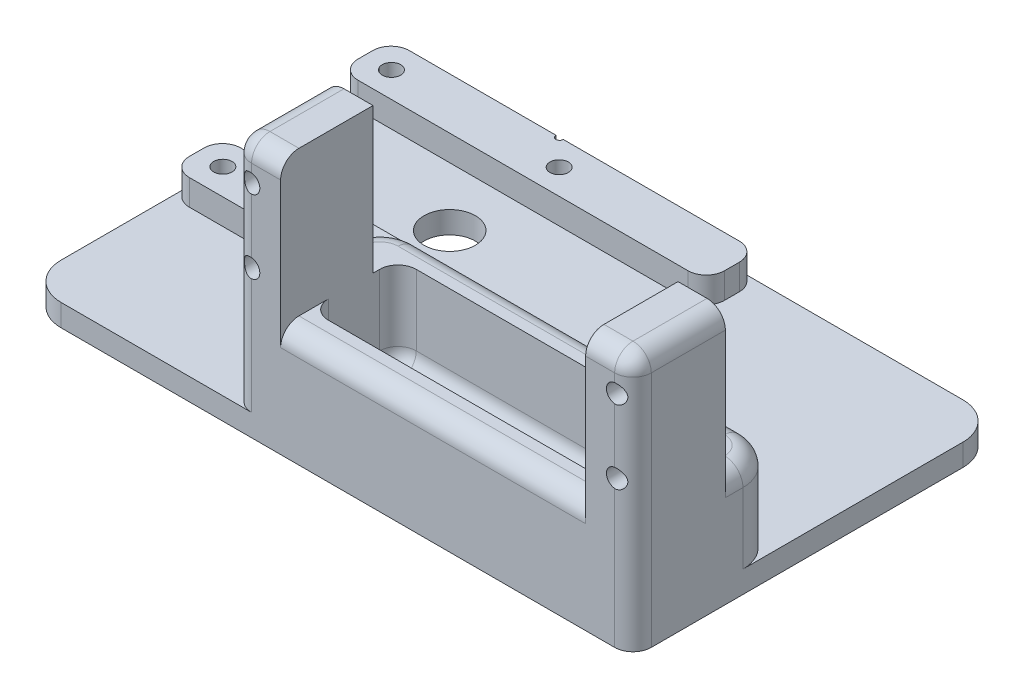
from build123d import *

# Parameters (mm, degrees)
SKETCH1_W             = 83
SKETCH1_H             = 50
BOSS_EXTRUDE1_DEPTH   = 3
SKETCH2_W             = 50
SKETCH2_H             = 7
BOSS_EXTRUDE2_DEPTH   = 3.5
SKETCH3_W             = 6.457447236
SKETCH3_H             = 12.6
BOSS_EXTRUDE3_DEPTH   = 31.93
M3X0_5_TAPPED_HOLE1_D = 2.5
SKETCH6_W             = 54.514894472
SKETCH6_H             = 20
BOSS_EXTRUDE4_DEPTH   = 12.13
SKETCH10_W            = 41.6
SKETCH10_H            = 12
CUT_EXTRUDE2_DEPTH    = 12.13
FILLET1_R             = 5
FILLET2_R             = 5
FILLET3_R             = 2.5
FILLET4_R             = 2.5
FILLET5_R             = 2.5
M3X0_5_TAPPED_HOLE2_D = 2.5
SKETCH9_R             = 3.5
CUT_EXTRUDE1_DEPTH    = 59.023916735
FILLET6_R             = 2.5
CUT_EXTRUDE3_DEPTH    = 60.727338073


with BuildPart() as part:
    # Sketch1 → Boss-Extrude1 (new body)
    with BuildSketch(Plane(origin=(0, 0, 0), x_dir=(1, 0, 0), z_dir=(0, 1, 0))):
        Rectangle(SKETCH1_W, SKETCH1_H)
    extrude(amount=BOSS_EXTRUDE1_DEPTH)

    # Sketch2 → Boss-Extrude2 (add)
    with BuildSketch(Plane(origin=(0, 3, 0), x_dir=(1, 0, 0), z_dir=(0, 1, 0))):
        with Locations((-16.5, 21.5)):
            Rectangle(SKETCH2_W, SKETCH2_H)
        with Locations((-16.5, -1.5)):
            Rectangle(SKETCH2_W, SKETCH2_H)
    extrude(amount=BOSS_EXTRUDE2_DEPTH)

    # Sketch3 → Boss-Extrude3 (add)
    with BuildSketch(Plane(origin=(0, 3, 0), x_dir=(1, 0, 0), z_dir=(0, 1, 0))):
        with Locations((38.271276382, -18.7)):
            Rectangle(SKETCH3_W, SKETCH3_H)
        with Locations((-9.786170854, -18.7)):
            Rectangle(SKETCH3_W, SKETCH3_H)
    extrude(amount=BOSS_EXTRUDE3_DEPTH)

    # M3x0.5 Tapped Hole1 (through all)
    with Locations(Plane(origin=(0, 0, 12.4), x_dir=(-1, 0, 0), z_dir=(0, 0, -1))):
        with Locations((-39.132166065, 30.03), (-39.132166065, 20.03), (10.647060537, 20.03), (10.647060537, 30.03)):
            Hole(M3X0_5_TAPPED_HOLE1_D / 2)

    # Sketch6 → Boss-Extrude4 (add)
    with BuildSketch(Plane(origin=(0, 3, 0), x_dir=(1, 0, 0), z_dir=(0, 1, 0))):
        with Locations((14.242552764, -15)):
            Rectangle(SKETCH6_W, SKETCH6_H)
    extrude(amount=BOSS_EXTRUDE4_DEPTH)

    # Sketch10 → Cut-Extrude2 (cut)
    with BuildSketch(Plane(origin=(0, 15.13, 0), x_dir=(1, 0, 0), z_dir=(0, 1, 0))):
        with Locations((14.242552764, -15)):
            Rectangle(SKETCH10_W, SKETCH10_H)
    extrude(amount=-CUT_EXTRUDE2_DEPTH, mode=Mode.SUBTRACT)

    # Fillet1
    fillet1_edges = [part.edges().sort_by_distance(p)[0] for p in [
        (8.5, 4.75, 5),
        (41.5, 9.065, 5),
        (-13.014894472, 4.75, 5),
    ]]
    fillet(fillet1_edges, radius=FILLET1_R)

    # Fillet2
    fillet2_edges = [part.edges().sort_by_distance(p)[0] for p in [
        (-13.014894472, 10.815, 5),
        (-41.5, 1.5, 25),
        (41.5, 1.5, -25),
    ]]
    fillet(fillet2_edges, radius=FILLET2_R)

    # Fillet3
    fillet3_edges = [part.edges().sort_by_distance(p)[0] for p in [
        (8.5, 4.75, -18),
        (-41.5, 4.75, -18),
        (-41.5, 4.75, -2),
        (8.5, 4.75, -2),
        (8.5, 4.75, -25),
        (-41.5, 4.75, 5),
        (-41.5, 3.25, -25),
    ]]
    fillet(fillet3_edges, radius=FILLET3_R)

    # Fillet4
    fillet4_edges = [part.edges().sort_by_distance(p)[0] for p in [
        (14.242552764, 15.13, 5),
        (40.035533906, 15.13, 6.464466094),
        (-13.014894472, 15.13, 11.2),
        (-11.550428378, 15.13, 6.464466094),
        (41.5, 15.13, 11.2),
        (14.242552764, 15.13, 25),
    ]]
    fillet(fillet4_edges, radius=FILLET4_R)

    # Fillet5
    # the kernel refuses this fillet: 2.5 mm, written as the material it takes off along each edge
    with BuildSketch(Plane(origin=(39, 32.43, 22.5), x_dir=(1, 0, 0), z_dir=(0, 0, 1))) as fillet5_piece_1_section:
        Polygon((0, 0), (FILLET5_R * 1.02, 0), (FILLET5_R * 1.02, FILLET5_R * 1.02), (0, FILLET5_R * 1.02), align=None)
    fillet5_piece_1 = extrude(amount=FILLET5_R * 1.02, mode=Mode.PRIVATE)
    fillet5_piece_1 = fillet5_piece_1 - Plane(origin=(39, 32.43, 22.5), x_dir=(-0.7071067811865475, -0.7071067811865475, 0), z_dir=(0, 0, 1)) * Sphere(FILLET5_R, mode=Mode.PRIVATE)
    add(fillet5_piece_1, mode=Mode.SUBTRACT)
    with BuildSketch(Plane(origin=(-10.514894472, 32.43, 22.5), x_dir=(-1, 0, 0), z_dir=(0, 0, 1))) as fillet5_piece_2_section:
        Polygon((0, 0), (FILLET5_R * 1.02, 0), (FILLET5_R * 1.02, -FILLET5_R * 1.02), (0, -FILLET5_R * 1.02), align=None)
    fillet5_piece_2 = extrude(amount=FILLET5_R * 1.02, mode=Mode.PRIVATE)
    fillet5_piece_2 = fillet5_piece_2 - Plane(origin=(-10.514894472, 32.43, 22.5), x_dir=(0.7071067811865475, -0.7071067811865475, 0), z_dir=(0, 0, 1)) * Sphere(FILLET5_R, mode=Mode.PRIVATE)
    add(fillet5_piece_2, mode=Mode.SUBTRACT)
    with BuildSketch(Plane(origin=(39, 34.93, 25), x_dir=(0, -1, 0), z_dir=(-1, 0, 0))) as fillet5_piece_3:
        with BuildLine():
            CenterArc((FILLET5_R, -FILLET5_R), FILLET5_R, 90, 90)
            Line((0, -FILLET5_R), (0, 0))
            Line((0, 0), (FILLET5_R, 0))
        make_face()
    extrude(amount=10.207447236, mode=Mode.SUBTRACT)
    with BuildSketch(Plane(origin=(41.5, 34.93, 6.15), x_dir=(-1, 0, 0), z_dir=(0, 0, 1)), Plane(origin=(-13.014894472, 34.93, 6.15), x_dir=(0, -1, 0), z_dir=(0, 0, 1))) as fillet5_piece_4:
        with BuildLine():
            CenterArc((FILLET5_R, FILLET5_R), FILLET5_R, 180, 90)
            Line((0, FILLET5_R), (0, 0))
            Line((0, 0), (FILLET5_R, 0))
        make_face()
    extrude(amount=16.35, mode=Mode.SUBTRACT)
    with BuildSketch(Plane(origin=(-10.514894472, 34.93, 25), x_dir=(0, -1, 0), z_dir=(1, 0, 0))) as fillet5_piece_5:
        with BuildLine():
            CenterArc((FILLET5_R, FILLET5_R), FILLET5_R, 180, 90)
            Line((0, FILLET5_R), (0, 0))
            Line((0, 0), (FILLET5_R, 0))
        make_face()
    extrude(amount=10.207447236, mode=Mode.SUBTRACT)
    with BuildSketch(Plane(origin=(-13.014894472, 32.43, 25), x_dir=(1, 0, 0), z_dir=(0, -1, 0))) as fillet5_piece_6:
        with BuildLine():
            CenterArc((FILLET5_R, -FILLET5_R), FILLET5_R, 90, 90)
            Line((0, -FILLET5_R), (0, 0))
            Line((0, 0), (FILLET5_R, 0))
        make_face()
    extrude(amount=29.43, mode=Mode.SUBTRACT)
    with BuildSketch(Plane(origin=(41.5, 32.43, 25), x_dir=(-1, 0, 0), z_dir=(0, -1, 0))) as fillet5_piece_7:
        with BuildLine():
            CenterArc((FILLET5_R, FILLET5_R), FILLET5_R, 180, 90)
            Line((0, FILLET5_R), (0, 0))
            Line((0, 0), (FILLET5_R, 0))
        make_face()
    extrude(amount=38.68, mode=Mode.SUBTRACT)

    # M3x0.5 Tapped Hole2 (through all)
    with Locations(Plane(origin=(0, 6.5, 0), x_dir=(1, 0, 0), z_dir=(0, 1, 0))):
        with Locations((-37.99546971, -1.433732), (-15.066268, -1.49546971), (-15.00453029, 21.433732), (-37.933732, 21.49546971)):
            Hole(M3X0_5_TAPPED_HOLE2_D / 2)

    # Sketch9 → Cut-Extrude1 (cut, through all)
    with BuildSketch(Plane(origin=(0, 3, 0), x_dir=(1, 0, 0), z_dir=(0, 1, 0))):
        with Locations(Location((-18.5, 10, 0), (0, 0, 270))):
            Circle(SKETCH9_R)
    extrude(amount=-CUT_EXTRUDE1_DEPTH, mode=Mode.SUBTRACT)

    # Fillet6
    fillet6_edges = [part.edges().sort_by_distance(p)[0] for p in [
        (-6.557447236, 9.065, 21),
        (-6.557447236, 9.065, 9),
        (35.042552764, 9.065, 9),
        (35.042552764, 9.065, 21),
        (-6.557447236, 3, 15),
        (14.242552764, 3, 9),
        (35.042552764, 3, 15),
        (14.242552764, 3, 21),
    ]]
    fillet(fillet6_edges, radius=FILLET6_R)

    # Sketch11 → Cut-Extrude3 (cut, through all)
    with BuildSketch(Plane.XZ):
        with BuildLine():
            Line((-19, -25), (-18, -25))
            ThreePointArc((-18, -25), (-18.5, -24.5), (-19, -25))
        make_face()
    extrude(amount=-CUT_EXTRUDE3_DEPTH, mode=Mode.SUBTRACT)


solid = part.part
